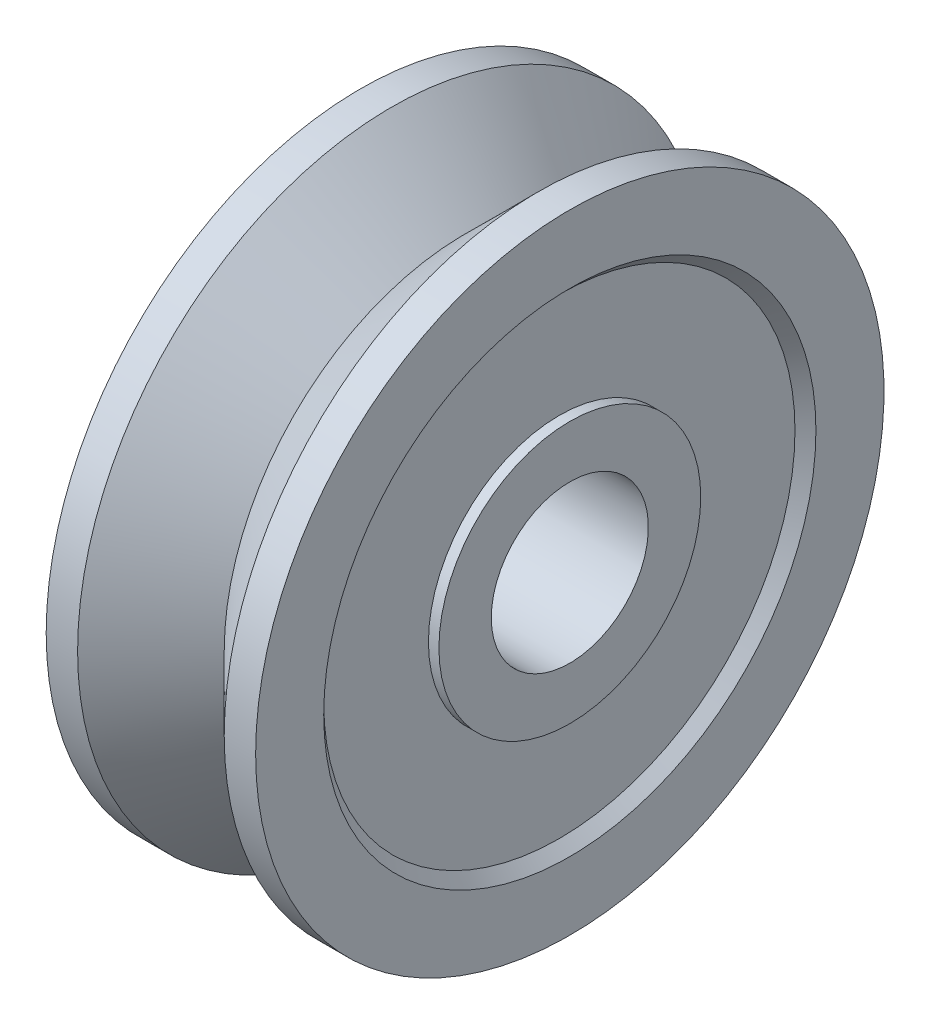
from build123d import *

# Parameters (mm, degrees)
SKETCH_2_R          = 4.5
SKETCH_2_R_2        = 2.5
CUT_EXTRUDE_1_DEPTH = 0.2
CHAMFER_1_SIZE      = 0.2
CUT_EXTRUDE_START   = -0.2
SKETCH_3_R          = 4.5
SKETCH_3_R_2        = 2.5
CUT_EXTRUDE_2_DEPTH = 0.2
CHAMFER_2_SIZE      = 0.2


with BuildPart() as part:
    # 草图1 → 旋转1 (revolve)
    with BuildSketch(Plane.XY, mode=Mode.PRIVATE) as revolve_1_sk:
        Polygon((-2, 1.5), (-2, 6), (-1.4, 6), (0, 4.6), (1.4, 6), (2, 6), (2, 1.5), align=None)
    revolve(revolve_1_sk.sketch.rotate(Axis((-2, 0, 0), (1, 0, 0)), 90), axis=Axis((-2, 0, 0), (1, 0, 0)))

    # 草图2 → 切除-拉伸1 (cut)
    with BuildSketch(Plane(origin=(2, 0, 0), x_dir=(0, 0, -1), z_dir=(1, 0, 0))):
        Circle(SKETCH_2_R)
        Circle(SKETCH_2_R_2, mode=Mode.SUBTRACT)
    extrude(amount=-CUT_EXTRUDE_1_DEPTH, mode=Mode.SUBTRACT)

    # 倒角1
    chamfer_1_edges = [part.edges().sort_by_distance(p)[0] for p in [
        (2, 0, 4.5),
    ]]
    chamfer(chamfer_1_edges, length=CHAMFER_1_SIZE - 0.0001)  # a hair under: the kernel refuses the full size

    # 草图3 → 切除-拉伸2 (cut)
    with BuildSketch(Plane.ZY.offset(2).offset(CUT_EXTRUDE_START)):
        Circle(SKETCH_3_R)
        with Locations(Location((0, 0, 0), (0, 0, 180))):
            Circle(SKETCH_3_R_2, mode=Mode.SUBTRACT)
    extrude(amount=CUT_EXTRUDE_2_DEPTH, mode=Mode.SUBTRACT)

    # 倒角2
    chamfer_2_edges = [part.edges().sort_by_distance(p)[0] for p in [
        (-2, 0, -4.5),
    ]]
    chamfer(chamfer_2_edges, length=CHAMFER_2_SIZE - 0.0001)  # a hair under: the kernel refuses the full size


solid = part.part
